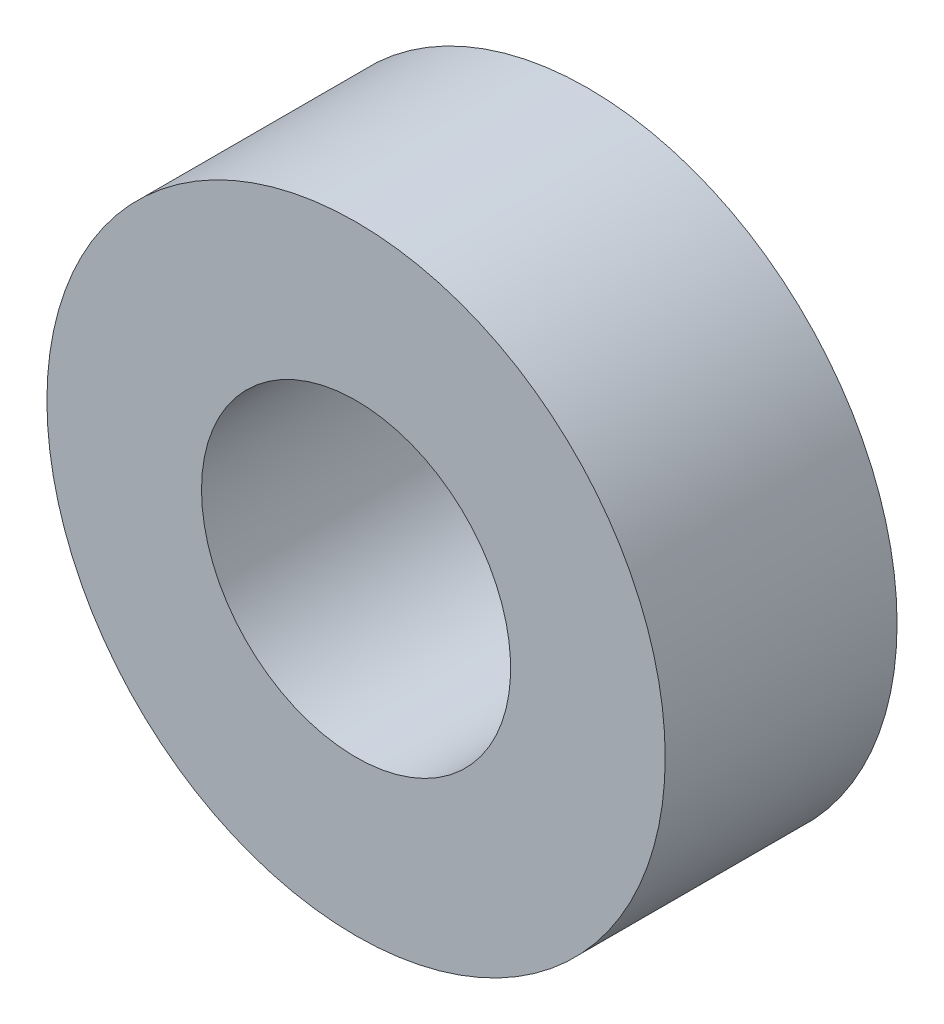
from build123d import *

# Parameters (mm, degrees)
SKETCH1_R      = 6.35
EXTRUDE1_DEPTH = 4.7625
SKETCH2_R      = 3.175
EXTRUDE2_DEPTH = 11.164959727


with BuildPart() as part:
    # Sketch1 → Extrude1 (new body)
    with BuildSketch(Plane.XY):
        Circle(SKETCH1_R)
    extrude(amount=EXTRUDE1_DEPTH)

    # Sketch2 → Extrude2 (cut, through all)
    with BuildSketch(Plane(origin=(0, 0, 0), x_dir=(-1, 0, 0), z_dir=(0, 0, -1))):
        Circle(SKETCH2_R)
    extrude(amount=-EXTRUDE2_DEPTH, mode=Mode.SUBTRACT)


solid = part.part
